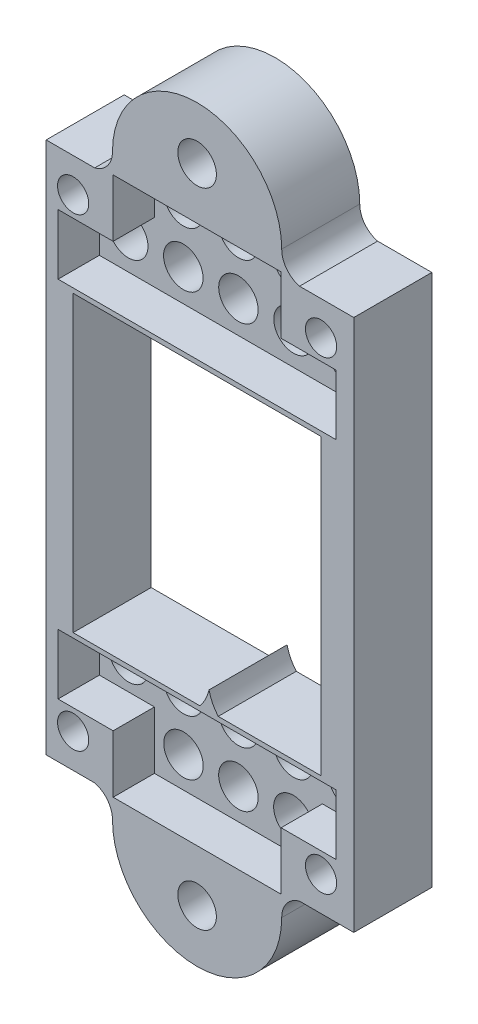
from build123d import *

# Parameters (mm, degrees)
SKETCH1_R           = 1.7
SKETCH1_R_2         = 2.1
BOSS_EXTRUDE1_DEPTH = 8.5
SKETCH2_R           = 2.15
CUT_EXTRUDE1_DEPTH  = 8.2
CUT_EXTRUDE3_DEPTH  = 4.5


# Read off the part's stored shape, not the designer's step: AdvancedHole1
with BuildPart() as part:
    # Sketch1 → Boss-Extrude1 (new body)
    with BuildSketch(Plane.XY):
        with BuildLine():
            Line((-16.436457619, 29), (-11.155935204, 29))
            ThreePointArc((-11.155935204, 29), (-9.748616749, 29.926511277), (-9.214880919, 31.524664725))
            ThreePointArc((-9.214880919, 31.524664725), (0, 40.739545643), (9.214880919, 31.524664725))
            ThreePointArc((9.214880919, 31.524664725), (9.748616749, 29.926511277), (11.155935204, 29))
            Line((11.155935204, 29), (17.063542381, 29))
            Line((17.063542381, 29), (17.063542381, -29))
            Line((17.063542381, -29), (11.155935204, -29))
            ThreePointArc((11.155935204, -29), (9.748616749, -29.926511277), (9.214880919, -31.524664725))
            ThreePointArc((9.214880919, -31.524664725), (0, -40.739545643), (-9.214880919, -31.524664725))
            ThreePointArc((-9.214880919, -31.524664725), (-9.748616749, -29.926511277), (-11.155935204, -29))
            Line((-11.155935204, -29), (-16.436457619, -29))
            Line((-16.436457619, -29), (-16.436457619, 29))
        make_face()
        with Locations((-13.5, 25.3)):
            Circle(SKETCH1_R, mode=Mode.SUBTRACT)
        with Locations((13.5, -25.3)):
            Circle(SKETCH1_R, mode=Mode.SUBTRACT)
        with Locations((-13.5, -25.3)):
            Circle(SKETCH1_R, mode=Mode.SUBTRACT)
        with Locations((13.5, 25.3)):
            Circle(SKETCH1_R, mode=Mode.SUBTRACT)
        with Locations((0, 35)):
            Circle(SKETCH1_R_2, mode=Mode.SUBTRACT)
        with Locations(Location((0, -35, 0), (0, 0, 180))):
            Circle(SKETCH1_R_2, mode=Mode.SUBTRACT)
        with BuildLine():
            Line((-13.5, 16), (13.5, 16))
            Line((13.5, 16), (13.5, -16))
            Line((13.5, -16), (2.3, -16))
            ThreePointArc((2.3, -16), (1.678013477, -15.060993262), (1.3, -14))
            ThreePointArc((1.3, -14), (0.921986523, -15.060993262), (0.3, -16))
            Line((0.3, -16), (-13.5, -16))
            Line((-13.5, -16), (-13.5, 16))
        make_face(mode=Mode.SUBTRACT)
    extrude(amount=BOSS_EXTRUDE1_DEPTH)

    # Sketch2 → Cut-Extrude1 (cut)
    with BuildSketch(Plane.XY.offset(8.5)):
        with Locations((-12, 20)):
            Circle(SKETCH2_R)
        with Locations((-6, 20)):
            Circle(SKETCH2_R)
        with Locations((0, 20)):
            Circle(SKETCH2_R)
        with Locations((6, 20)):
            Circle(SKETCH2_R)
        with Locations((12, 20)):
            Circle(SKETCH2_R)
        with Locations((-6, 26)):
            Circle(SKETCH2_R)
        with Locations((0, 26)):
            Circle(SKETCH2_R)
        with Locations((6, 26)):
            Circle(SKETCH2_R)
        with Locations((-11.967349369, -20)):
            Circle(SKETCH2_R)
        with Locations((-5.983674685, -20)):
            Circle(SKETCH2_R)
        with Locations((0, -20)):
            Circle(SKETCH2_R)
        with Locations((5.983674685, -20)):
            Circle(SKETCH2_R)
        with Locations((11.967349369, -20)):
            Circle(SKETCH2_R)
        with Locations((-5.983674685, -26)):
            Circle(SKETCH2_R)
        with Locations((0, -26)):
            Circle(SKETCH2_R)
        with Locations((5.983674685, -26)):
            Circle(SKETCH2_R)
    extrude(amount=-CUT_EXTRUDE1_DEPTH, mode=Mode.SUBTRACT)

    # AdvancedHole1 outline → AdvancedHole1 (revolve, cut)
    with BuildSketch(Plane(origin=(-13.5, -25.3, 0), x_dir=(1, 0, 0), z_dir=(0, -1, 0))):
        Polygon((3.47, 0), (1.7, 1.77), (1.7, 0), align=None)
    revolve(axis=Axis((-13.5, -25.3, 0), (0, 0, 1)), mode=Mode.SUBTRACT)

    # AdvancedHole1 2 outline → AdvancedHole1 2 (revolve, cut)
    with BuildSketch(Plane(origin=(13.5, -25.3, 0), x_dir=(1, 0, 0), z_dir=(0, -1, 0))):
        Polygon((3.47, 0), (1.7, 1.77), (1.7, 0), align=None)
    revolve(axis=Axis((13.5, -25.3, 0), (0, 0, 1)), mode=Mode.SUBTRACT)

    # AdvancedHole1 3 outline → AdvancedHole1 3 (revolve, cut)
    with BuildSketch(Plane(origin=(-13.5, 25.3, 0), x_dir=(1, 0, 0), z_dir=(0, -1, 0))):
        Polygon((3.47, 0), (1.7, 1.77), (1.7, 0), align=None)
    revolve(axis=Axis((-13.5, 25.3, 0), (0, 0, 1)), mode=Mode.SUBTRACT)

    # AdvancedHole1 4 outline → AdvancedHole1 4 (revolve, cut)
    with BuildSketch(Plane(origin=(13.5, 25.3, 0), x_dir=(1, 0, 0), z_dir=(0, -1, 0))):
        Polygon((3.47, 0), (1.7, 1.77), (1.7, 0), align=None)
    revolve(axis=Axis((13.5, 25.3, 0), (0, 0, 1)), mode=Mode.SUBTRACT)

    # Sketch6 → Cut-Extrude3 (cut)
    with BuildSketch(Plane.XY.offset(8.5)):
        Polygon((-9.144659307, 29.348390155), (9.144659307, 29.348390155), (9.144659307, 23.081210136), (15.140663267, 23.081210136), (15.140663267, 16.512723385), (-15.140663267, 16.512723385), (-15.140663267, 23.081210136), (-9.144659307, 23.081210136), align=None)
        Polygon((-9.144659307, -23.081210136), (-15.140663267, -23.081210136), (-15.140663267, -16.512723385), (15.140663267, -16.512723385), (15.140663267, -23.081210136), (9.144659307, -23.081210136), (9.144659307, -29.348390155), (-9.144659307, -29.348390155), align=None)
    extrude(amount=-CUT_EXTRUDE3_DEPTH, mode=Mode.SUBTRACT)


solid = part.part
